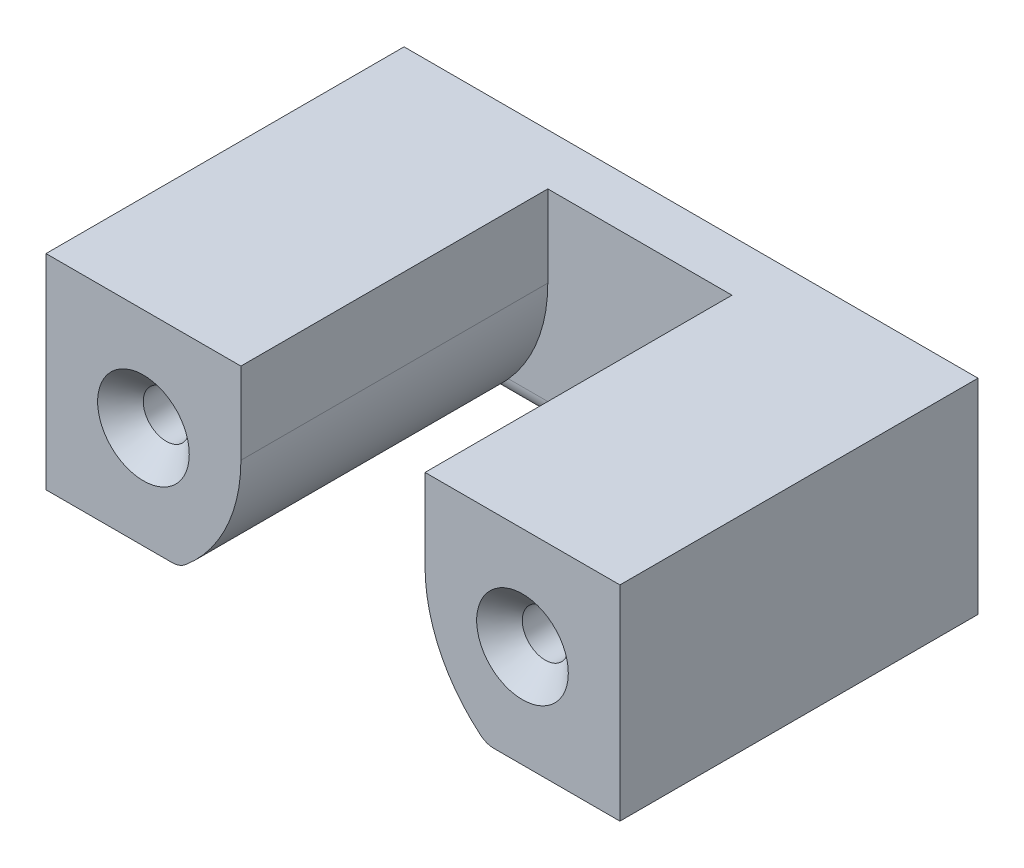
from build123d import *

# Parameters (mm, degrees)
SKETCH_1_W                  = 56.1
SKETCH_1_H                  = 20
EXTRUDE_1_DEPTH             = 5
EXTRUDE_2_DEPTH             = 30
HOLE_WIZARD_M41_D           = 4.5
HOLE_WIZARD_M41_CSINK_D     = 8.96
HOLE_WIZARD_M41_CSINK_ANGLE = 90
FILLET_1_R                  = 2


with BuildPart() as part:
    # Эскиз1 → Бобышка-Вытянуть1 (new body)
    with BuildSketch(Plane.XY):
        with Locations((28.05, 10)):
            Rectangle(SKETCH_1_W, SKETCH_1_H)
    extrude(amount=EXTRUDE_1_DEPTH)

    # Эскиз2 → Бобышка-Вытянуть2 (add)
    with BuildSketch(Plane.XY.offset(5)):
        with BuildLine():
            Line((19.05, 12.02562419), (19.05, 20))
            Line((19.05, 20), (0, 20))
            Line((0, 20), (0, 0))
            Line((0, 0), (13.05, 0))
            Line((13.05, 0), (13.652765995, 0.502304996))
            ThreePointArc((13.652765995, 0.502304996), (17.633841318, 5.663293246), (19.05, 12.02562419))
        make_face()
        with BuildLine():
            Line((56.1, 20), (37.05, 20))
            Line((37.05, 20), (37.05, 12.02562419))
            ThreePointArc((37.05, 12.02562419), (38.466158682, 5.663293246), (42.447234005, 0.502304996))
            Line((42.447234005, 0.502304996), (43.05, 0))
            Line((43.05, 0), (56.1, 0))
            Line((56.1, 0), (56.1, 20))
        make_face()
    extrude(amount=EXTRUDE_2_DEPTH)

    # Зенковка для  винта с потайной головкой с внутренним шестигранником M41 (through all)
    with Locations(Plane(origin=(9.525, 10, 35), x_dir=(1, 0, 0), z_dir=(0, 0, 1))):
        with Locations((0, 0), (37.05, 0)):
            CounterSinkHole(HOLE_WIZARD_M41_D / 2, HOLE_WIZARD_M41_CSINK_D / 2, counter_sink_angle=HOLE_WIZARD_M41_CSINK_ANGLE)

    # Скругление1
    fillet_1_edges = [part.edges().sort_by_distance(p)[0] for p in [
        (28.05, 0, 5),
    ]]
    fillet(fillet_1_edges, radius=FILLET_1_R)
    fillet_1_2_edges = [part.edges().sort_by_distance(p)[0] for p in [
        (13.05, 0, 19),
    ]]
    fillet(fillet_1_2_edges, radius=FILLET_1_R)
    fillet_1_3_edges = [part.edges().sort_by_distance(p)[0] for p in [
        (43.05, 0, 19.000000047),
    ]]
    fillet(fillet_1_3_edges, radius=FILLET_1_R)


solid = part.part
